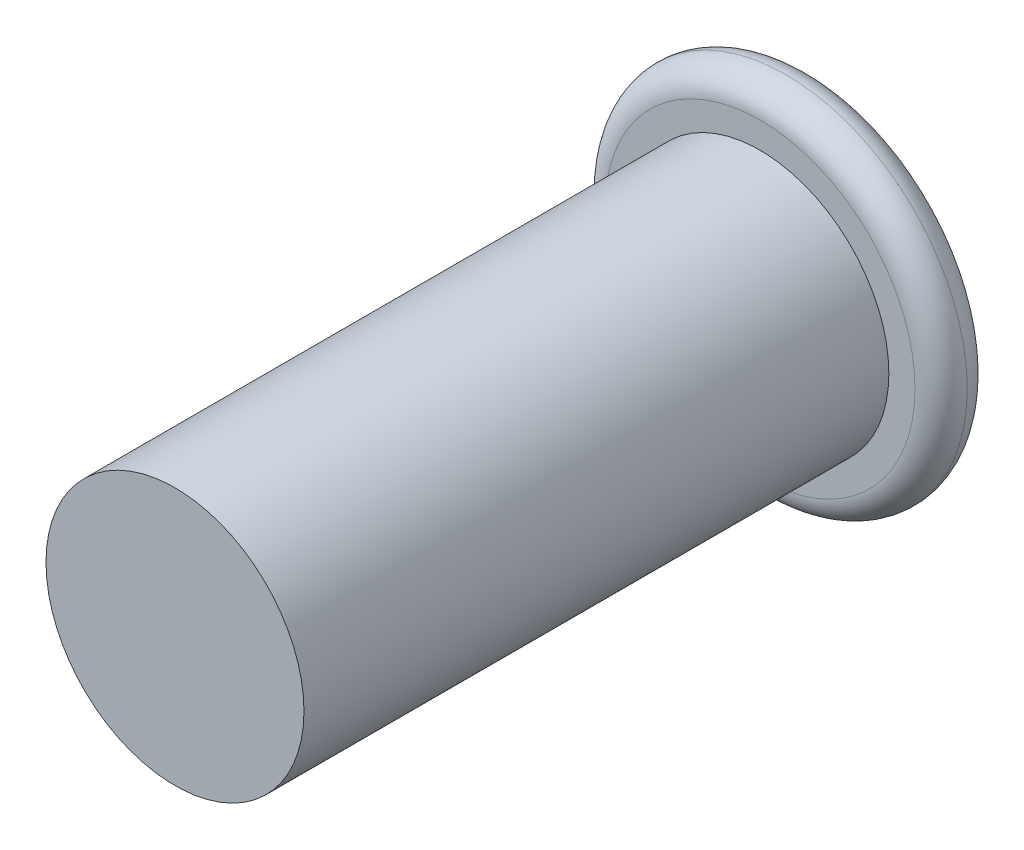
from build123d import *

# Parameters (mm, degrees)
SKETCH1_R           = 1.235
BOSS_EXTRUDE1_DEPTH = 5.6
SKETCH2_R           = 1.735
BOSS_EXTRUDE2_DEPTH = 0.5
FILLET1_R           = 0.25


with BuildPart() as part:
    # Sketch1 → Boss-Extrude1 (new body)
    with BuildSketch(Plane.XY):
        Circle(SKETCH1_R)
    extrude(amount=BOSS_EXTRUDE1_DEPTH)

    # Sketch2 → Boss-Extrude2 (add)
    with BuildSketch(Plane(origin=(0, 0, 0), x_dir=(-1, 0, 0), z_dir=(0, 0, -1))):
        Circle(SKETCH2_R)
    extrude(amount=BOSS_EXTRUDE2_DEPTH)

    # Fillet1
    fillet1_edges = [part.edges().sort_by_distance(p)[0] for p in [
        (1.735, 0, 0),
        (1.735, 0, -0.5),
    ]]
    fillet(fillet1_edges, radius=FILLET1_R - 0.0001)  # a hair under: the kernel refuses the full size


solid = part.part
